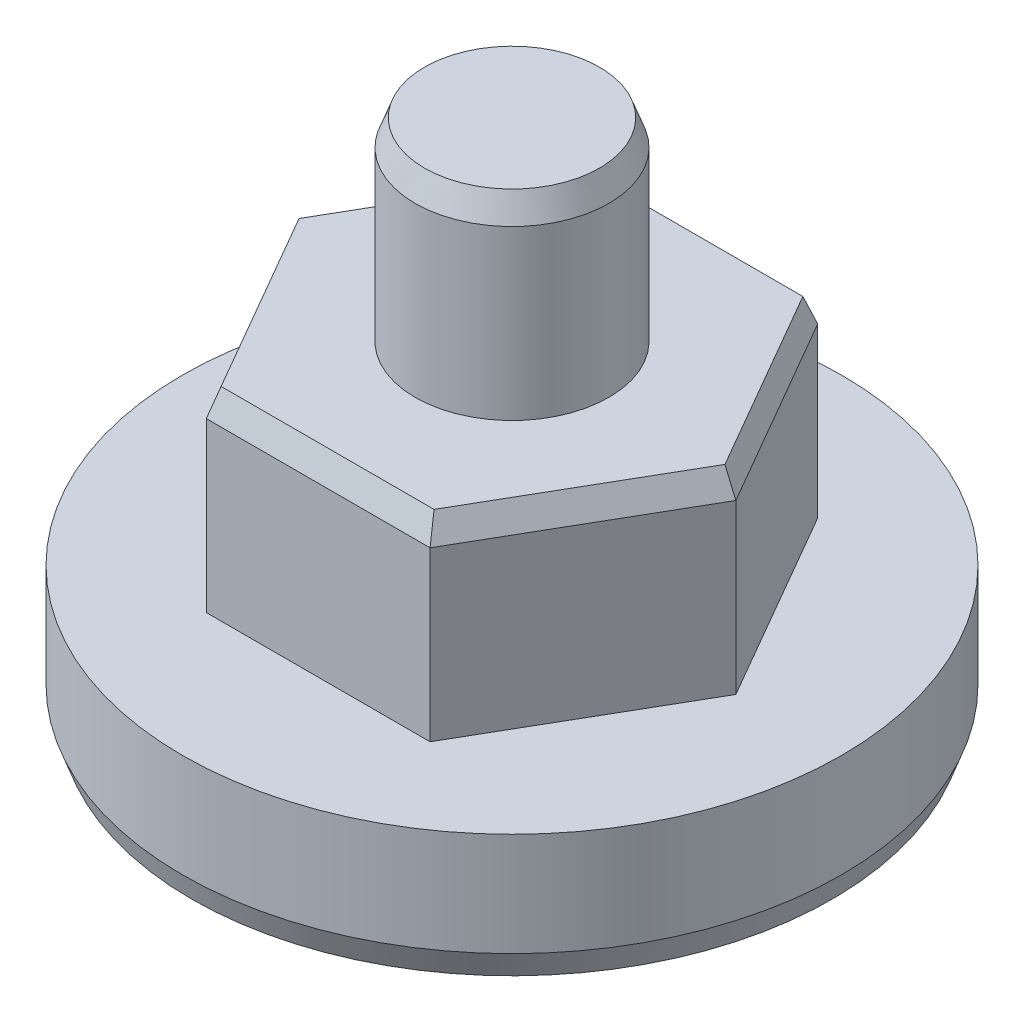
from build123d import *
from OCP.BRepFilletAPI import BRepFilletAPI_MakeChamfer

# Parameters (mm, degrees)
SKETCH1_R           = 25.5
BOSS_EXTRUDE1_DEPTH = 5
BOSS_EXTRUDE2_DEPTH = 15
SKETCH3_R           = 7.5
BOSS_EXTRUDE3_DEPTH = 15
CHAMFER1_SIZE       = 2
CHAMFER1_SIZE2      = 0.727940469
CHAMFER2_SIZE       = 2
CHAMFER2_SIZE2      = 0.727940469
CHAMFER3_SIZE       = 2
CHAMFER3_SIZE2      = 0.727940469


with BuildPart() as part:
    # Sketch1 → Boss-Extrude1 (new, symmetric)
    with BuildSketch(Plane(origin=(0, 0, 0), x_dir=(1, 0, 0), z_dir=(0, 1, 0))):
        Circle(SKETCH1_R)
    extrude(amount=BOSS_EXTRUDE1_DEPTH, both=True)

    # Sketch2 → Boss-Extrude2 (add)
    with BuildSketch(Plane(origin=(0, 5, 0), x_dir=(1, 0, 0), z_dir=(0, 1, 0))):
        Polygon((-17.320508076, 0), (-8.660254038, -15), (8.660254038, -15), (17.320508076, 0), (8.660254038, 15), (-8.660254038, 15), align=None)
    extrude(amount=BOSS_EXTRUDE2_DEPTH)

    # Sketch3 → Boss-Extrude3 (add)
    with BuildSketch(Plane(origin=(0, 20, 0), x_dir=(1, 0, 0), z_dir=(0, 1, 0))):
        Circle(SKETCH3_R)
    extrude(amount=BOSS_EXTRUDE3_DEPTH)

    # Chamfer1: one chamfer whose edges measure the first distance from different faces: ONE call of the kernel's chamfer builder (chamfer() names one face for all edges)
    chamfer1_edges_1 = [part.edges().sort_by_distance(p)[0] for p in [
        (-12.990381057, 20, -7.5),
    ]]
    chamfer1_side_1 = [part.faces().sort_by_distance(p)[0] for p in [
        (-12.990381057, 12.5, -7.5),
    ]]
    chamfer1_edges_2 = [part.edges().sort_by_distance(p)[0] for p in [
        (-12.990381057, 20, 7.5),
    ]]
    chamfer1_side_2 = [part.faces().sort_by_distance(p)[0] for p in [
        (-12.990381057, 12.5, 7.5),
    ]]
    chamfer1_edges_3 = [part.edges().sort_by_distance(p)[0] for p in [
        (0, 20, 15),
    ]]
    chamfer1_side_3 = [part.faces().sort_by_distance(p)[0] for p in [
        (0, 12.5, 15),
    ]]
    chamfer1_edges_4 = [part.edges().sort_by_distance(p)[0] for p in [
        (12.990381057, 20, 7.5),
    ]]
    chamfer1_side_4 = [part.faces().sort_by_distance(p)[0] for p in [
        (12.990381057, 12.5, 7.5),
    ]]
    chamfer1_edges_5 = [part.edges().sort_by_distance(p)[0] for p in [
        (12.990381057, 20, -7.5),
    ]]
    chamfer1_side_5 = [part.faces().sort_by_distance(p)[0] for p in [
        (12.990381057, 12.5, -7.5),
    ]]
    chamfer1_edges_6 = [part.edges().sort_by_distance(p)[0] for p in [
        (0, 20, -15),
    ]]
    chamfer1_side_6 = [part.faces().sort_by_distance(p)[0] for p in [
        (0, 12.5, -15),
    ]]
    chamfer1 = BRepFilletAPI_MakeChamfer(part.part.solid().wrapped)
    for e in chamfer1_edges_1:
        chamfer1.Add(CHAMFER1_SIZE, CHAMFER1_SIZE2, e.wrapped, chamfer1_side_1[0].wrapped)  # the first distance lies on this face
    for e in chamfer1_edges_2:
        chamfer1.Add(CHAMFER1_SIZE, CHAMFER1_SIZE2, e.wrapped, chamfer1_side_2[0].wrapped)  # the first distance lies on this face
    for e in chamfer1_edges_3:
        chamfer1.Add(CHAMFER1_SIZE, CHAMFER1_SIZE2, e.wrapped, chamfer1_side_3[0].wrapped)  # the first distance lies on this face
    for e in chamfer1_edges_4:
        chamfer1.Add(CHAMFER1_SIZE, CHAMFER1_SIZE2, e.wrapped, chamfer1_side_4[0].wrapped)  # the first distance lies on this face
    for e in chamfer1_edges_5:
        chamfer1.Add(CHAMFER1_SIZE, CHAMFER1_SIZE2, e.wrapped, chamfer1_side_5[0].wrapped)  # the first distance lies on this face
    for e in chamfer1_edges_6:
        chamfer1.Add(CHAMFER1_SIZE, CHAMFER1_SIZE2, e.wrapped, chamfer1_side_6[0].wrapped)  # the first distance lies on this face
    add(Compound.cast(chamfer1.Shape()), mode=Mode.REPLACE)

    # Chamfer2
    chamfer2_edges = [part.edges().sort_by_distance(p)[0] for p in [
        (-25.5, -5, 0),
    ]]
    chamfer2_side = [part.faces().sort_by_distance(p)[0] for p in [
        (-25.5, 0, 0),
    ]]
    chamfer(chamfer2_edges, length=CHAMFER2_SIZE, length2=CHAMFER2_SIZE2, reference=chamfer2_side[0])

    # Chamfer3
    chamfer3_edges = [part.edges().sort_by_distance(p)[0] for p in [
        (-7.5, 35, 0),
    ]]
    chamfer3_side = [part.faces().sort_by_distance(p)[0] for p in [
        (-7.5, 27.5, 0),
    ]]
    chamfer(chamfer3_edges, length=CHAMFER3_SIZE, length2=CHAMFER3_SIZE2, reference=chamfer3_side[0])


solid = part.part
